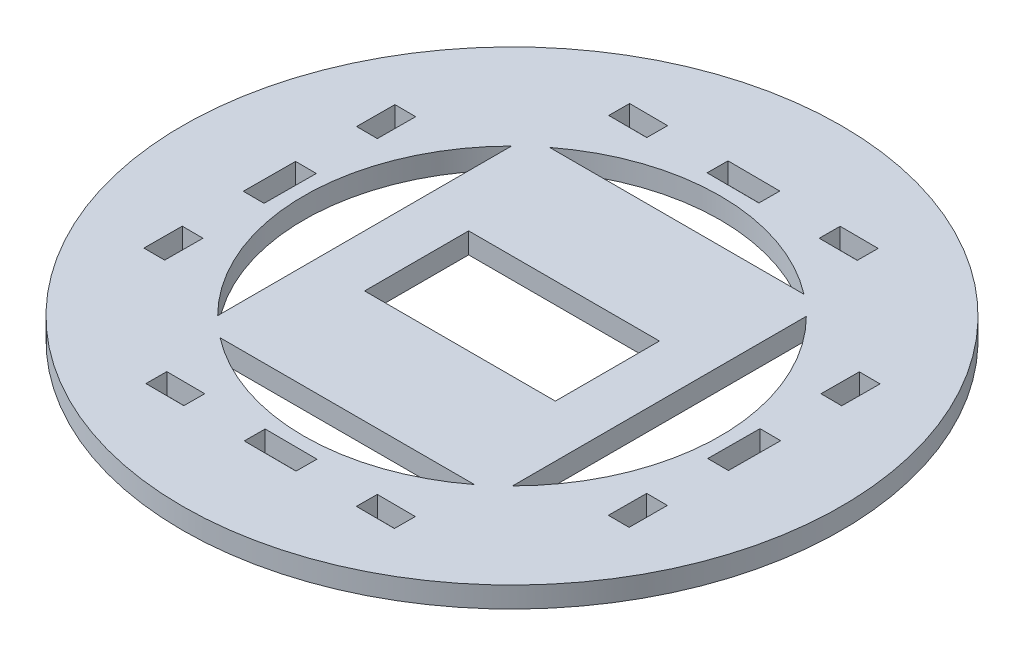
from build123d import *

# Parameters (mm, degrees)
SKETCH1_R             = 95
BOSS_EXTRUDE1_DEPTH   = 6
SKETCH2_W             = 55
SKETCH2_H             = 30
CUT_EXTRUDE1_DEPTH    = 135.484199815
CAVITY1_START         = -69.821849164
CAVITY1_OUTLINE_W     = 15
CAVITY1_OUTLINE_H     = 6
CAVITY1_OUTLINE_W_2   = 11
CAVITY1_DEPTH         = 6
CAVITY1_START_2       = 63.821772898
CAVITY1_2_OUTLINE_W   = 11
CAVITY1_2_OUTLINE_H   = 6
CAVITY1_2_OUTLINE_W_2 = 15
CAVITY1_2_DEPTH       = 6
CAVITY1_START_3       = -7.051829773
CAVITY1_3_OUTLINE_W   = 6
CAVITY1_3_OUTLINE_H   = 6
CAVITY1_3_DEPTH       = 14.103659546
CAVITY1_START_4       = -35.551829773
CAVITY1_4_OUTLINE_W   = 6
CAVITY1_4_OUTLINE_H   = 6
CAVITY1_4_DEPTH       = 10.103659546
CAVITY1_START_5       = 25.448170227
CAVITY1_5_OUTLINE_W   = 6
CAVITY1_5_OUTLINE_H   = 6
CAVITY1_5_DEPTH       = 10.103659546
CAVITY1_START_6       = -36.448170227
CAVITY1_6_OUTLINE_W   = 6
CAVITY1_6_OUTLINE_H   = 6
CAVITY1_6_DEPTH       = 0.896340454
CAVITY1_START_7       = -25.448170227
CAVITY1_7_OUTLINE_W   = 6
CAVITY1_7_OUTLINE_H   = 6
CAVITY1_7_DEPTH       = 0.896340454
CAVITY1_START_8       = -7.948170227
CAVITY1_8_OUTLINE_W   = 6
CAVITY1_8_OUTLINE_H   = 6
CAVITY1_8_DEPTH       = 0.896340454
CAVITY1_START_9       = 7.051829773
CAVITY1_9_OUTLINE_W   = 6
CAVITY1_9_OUTLINE_H   = 6
CAVITY1_9_DEPTH       = 0.896340454
CAVITY1_START_10      = 24.551829773
CAVITY1_10_OUTLINE_W  = 6
CAVITY1_10_OUTLINE_H  = 6
CAVITY1_10_DEPTH      = 0.896340454
CAVITY1_START_11      = 35.551829773
CAVITY1_11_OUTLINE_W  = 6
CAVITY1_11_OUTLINE_H  = 6
CAVITY1_11_DEPTH      = 0.896340454


# Read off the part's stored shape, not the designer's step: Cavity1
with BuildPart() as part:
    # Sketch1 → Boss-Extrude1 (new body)
    with BuildSketch(Plane(origin=(0, 0, 0), x_dir=(1, 0, 0), z_dir=(0, 1, 0))):
        with Locations(Location((0, 0, 0), (0, 0, 270))):
            Circle(SKETCH1_R)
        with BuildLine():
            Line((-36.657195747, -47.5), (36.657195747, -47.5))
            ThreePointArc((36.657195747, -47.5), (0, -60), (-36.657195747, -47.5))
        make_face(mode=Mode.SUBTRACT)
        with BuildLine():
            Line((-42.5, 42.352685865), (-42.5, -42.352685865))
            ThreePointArc((-42.5, -42.352685865), (-60, 0), (-42.5, 42.352685865))
        make_face(mode=Mode.SUBTRACT)
        with BuildLine():
            Line((36.657195747, 47.5), (-36.657195747, 47.5))
            ThreePointArc((-36.657195747, 47.5), (0, 60), (36.657195747, 47.5))
        make_face(mode=Mode.SUBTRACT)
        with BuildLine():
            Line((42.5, -42.352685865), (42.5, 42.352685865))
            ThreePointArc((42.5, 42.352685865), (60, 0), (42.5, -42.352685865))
        make_face(mode=Mode.SUBTRACT)
    extrude(amount=BOSS_EXTRUDE1_DEPTH)

    # Sketch2 → Cut-Extrude1 (cut, through all)
    with BuildSketch(Plane(origin=(0, 6, 0), x_dir=(1, 0, 0), z_dir=(0, 1, 0))):
        Rectangle(SKETCH2_W, SKETCH2_H)
    extrude(amount=-CUT_EXTRUDE1_DEPTH, mode=Mode.SUBTRACT)

    # Cavity1 outline → Cavity1 (cut)
    with BuildSketch(Plane(origin=(0, 0, 0), x_dir=(0.9999872892756082, 0, 0.005041952719030872), z_dir=(0.005041952719030872, 0, -0.9999872892756083)).offset(CAVITY1_START)):
        with Locations((0.448170227, -3)):
            Rectangle(CAVITY1_OUTLINE_W, CAVITY1_OUTLINE_H)
        with Locations((30.948170227, -3)):
            Rectangle(CAVITY1_OUTLINE_W_2, CAVITY1_OUTLINE_H)
        with Locations((-30.051829773, -3)):
            Rectangle(CAVITY1_OUTLINE_W_2, CAVITY1_OUTLINE_H)
    extrude(amount=CAVITY1_DEPTH, mode=Mode.SUBTRACT)

    # Cavity1 2 outline → Cavity1 2 (cut)
    with BuildSketch(Plane(origin=(0, 0, 0), x_dir=(0.9999872892756082, 0, 0.005041952719030872), z_dir=(0.005041952719030872, 0, -0.9999872892756083)).offset(CAVITY1_START_2)):
        with Locations((30.051829773, -3)):
            Rectangle(CAVITY1_2_OUTLINE_W, CAVITY1_2_OUTLINE_H)
        with Locations((-0.448170227, -3)):
            Rectangle(CAVITY1_2_OUTLINE_W_2, CAVITY1_2_OUTLINE_H)
        with Locations((-30.948170227, -3)):
            Rectangle(CAVITY1_2_OUTLINE_W, CAVITY1_2_OUTLINE_H)
    extrude(amount=CAVITY1_2_DEPTH, mode=Mode.SUBTRACT)

    # Cavity1 3 outline → Cavity1 3 (cut)
    with BuildSketch(Plane(origin=(0, 0, 0), x_dir=(0.9999872892756082, 0, 0.005041952719030872), z_dir=(0.005041952719030872, 0, -0.9999872892756083)).offset(CAVITY1_START_3)):
        with Locations((66.821849164, -3)):
            Rectangle(CAVITY1_3_OUTLINE_W, CAVITY1_3_OUTLINE_H)
        with Locations((-66.821849164, -3)):
            Rectangle(CAVITY1_3_OUTLINE_W, CAVITY1_3_OUTLINE_H)
    extrude(amount=CAVITY1_3_DEPTH, mode=Mode.SUBTRACT)

    # Cavity1 4 outline → Cavity1 4 (cut)
    with BuildSketch(Plane(origin=(0, 0, 0), x_dir=(0.9999872892756082, 0, 0.005041952719030872), z_dir=(0.005041952719030872, 0, -0.9999872892756083)).offset(CAVITY1_START_4)):
        with Locations((66.821849164, -3)):
            Rectangle(CAVITY1_4_OUTLINE_W, CAVITY1_4_OUTLINE_H)
        with Locations((-66.821849164, -3)):
            Rectangle(CAVITY1_4_OUTLINE_W, CAVITY1_4_OUTLINE_H)
    extrude(amount=CAVITY1_4_DEPTH, mode=Mode.SUBTRACT)

    # Cavity1 5 outline → Cavity1 5 (cut)
    with BuildSketch(Plane(origin=(0, 0, 0), x_dir=(0.9999872892756082, 0, 0.005041952719030872), z_dir=(0.005041952719030872, 0, -0.9999872892756083)).offset(CAVITY1_START_5)):
        with Locations((66.821849164, -3)):
            Rectangle(CAVITY1_5_OUTLINE_W, CAVITY1_5_OUTLINE_H)
        with Locations((-66.821849164, -3)):
            Rectangle(CAVITY1_5_OUTLINE_W, CAVITY1_5_OUTLINE_H)
    extrude(amount=CAVITY1_5_DEPTH, mode=Mode.SUBTRACT)

    # Cavity1 6 outline → Cavity1 6 (cut)
    with BuildSketch(Plane(origin=(0, 0, 0), x_dir=(0.9999872892756082, 0, 0.005041952719030872), z_dir=(0.005041952719030872, 0, -0.9999872892756083)).offset(CAVITY1_START_6)):
        with Locations((-66.821849164, -3)):
            Rectangle(CAVITY1_6_OUTLINE_W, CAVITY1_6_OUTLINE_H)
    extrude(amount=CAVITY1_6_DEPTH, mode=Mode.SUBTRACT)

    # Cavity1 7 outline → Cavity1 7 (cut)
    with BuildSketch(Plane(origin=(0, 0, 0), x_dir=(0.9999872892756082, 0, 0.005041952719030872), z_dir=(0.005041952719030872, 0, -0.9999872892756083)).offset(CAVITY1_START_7)):
        with Locations((66.821849164, -3)):
            Rectangle(CAVITY1_7_OUTLINE_W, CAVITY1_7_OUTLINE_H)
    extrude(amount=CAVITY1_7_DEPTH, mode=Mode.SUBTRACT)

    # Cavity1 8 outline → Cavity1 8 (cut)
    with BuildSketch(Plane(origin=(0, 0, 0), x_dir=(0.9999872892756082, 0, 0.005041952719030872), z_dir=(0.005041952719030872, 0, -0.9999872892756083)).offset(CAVITY1_START_8)):
        with Locations((-66.821849164, -3)):
            Rectangle(CAVITY1_8_OUTLINE_W, CAVITY1_8_OUTLINE_H)
    extrude(amount=CAVITY1_8_DEPTH, mode=Mode.SUBTRACT)

    # Cavity1 9 outline → Cavity1 9 (cut)
    with BuildSketch(Plane(origin=(0, 0, 0), x_dir=(0.9999872892756082, 0, 0.005041952719030872), z_dir=(0.005041952719030872, 0, -0.9999872892756083)).offset(CAVITY1_START_9)):
        with Locations((66.821849164, -3)):
            Rectangle(CAVITY1_9_OUTLINE_W, CAVITY1_9_OUTLINE_H)
    extrude(amount=CAVITY1_9_DEPTH, mode=Mode.SUBTRACT)

    # Cavity1 10 outline → Cavity1 10 (cut)
    with BuildSketch(Plane(origin=(0, 0, 0), x_dir=(0.9999872892756082, 0, 0.005041952719030872), z_dir=(0.005041952719030872, 0, -0.9999872892756083)).offset(CAVITY1_START_10)):
        with Locations((-66.821849164, -3)):
            Rectangle(CAVITY1_10_OUTLINE_W, CAVITY1_10_OUTLINE_H)
    extrude(amount=CAVITY1_10_DEPTH, mode=Mode.SUBTRACT)

    # Cavity1 11 outline → Cavity1 11 (cut)
    with BuildSketch(Plane(origin=(0, 0, 0), x_dir=(0.9999872892756082, 0, 0.005041952719030872), z_dir=(0.005041952719030872, 0, -0.9999872892756083)).offset(CAVITY1_START_11)):
        with Locations((66.821849164, -3)):
            Rectangle(CAVITY1_11_OUTLINE_W, CAVITY1_11_OUTLINE_H)
    extrude(amount=CAVITY1_11_DEPTH, mode=Mode.SUBTRACT)


solid = part.part
